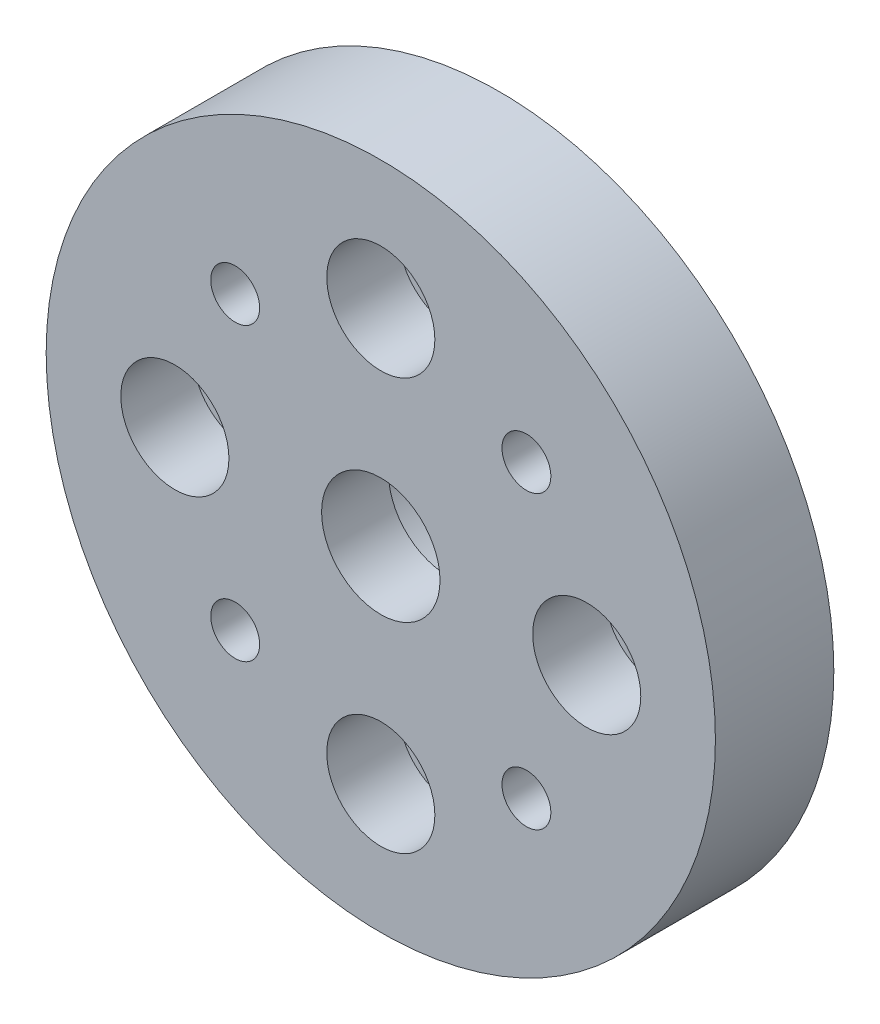
from build123d import *

# Parameters (mm, degrees)
SKETCH_1_R          = 13
SKETCH_1_R_2        = 2.3
SKETCH_1_R_3        = 1.1
SKETCH_1_R_4        = 0.95
EXTRUDE_1_DEPTH     = 4.6
SKETCH_2_R          = 2.1
CUT_EXTRUDE_1_DEPTH = 2.8
SKETCH_9_R          = 4.2
CUT_EXTRUDE_5_DEPTH = 2


with BuildPart() as part:
    # 스케치1 → 보스-돌출1 (new body)
    with BuildSketch(Plane.XY):
        Circle(SKETCH_1_R)
        Circle(SKETCH_1_R_2, mode=Mode.SUBTRACT)
        with Locations((0, 8)):
            Circle(SKETCH_1_R_3, mode=Mode.SUBTRACT)
        with Locations((8, 0)):
            Circle(SKETCH_1_R_3, mode=Mode.SUBTRACT)
        with Locations((0, -8)):
            Circle(SKETCH_1_R_3, mode=Mode.SUBTRACT)
        with Locations((-8, 0)):
            Circle(SKETCH_1_R_3, mode=Mode.SUBTRACT)
        with Locations((5.656854249, 5.656854249)):
            Circle(SKETCH_1_R_4, mode=Mode.SUBTRACT)
        with Locations((5.656854249, -5.656854249)):
            Circle(SKETCH_1_R_4, mode=Mode.SUBTRACT)
        with Locations((-5.656854249, -5.656854249)):
            Circle(SKETCH_1_R_4, mode=Mode.SUBTRACT)
        with Locations((-5.656854249, 5.656854249)):
            Circle(SKETCH_1_R_4, mode=Mode.SUBTRACT)
    extrude(amount=EXTRUDE_1_DEPTH)

    # 스케치2 → 컷-돌출1 (cut)
    with BuildSketch(Plane.XY.offset(4.6)):
        with Locations((0, 8)):
            Circle(SKETCH_2_R)
        with Locations((8, 0)):
            Circle(SKETCH_2_R)
        with Locations((0, -8)):
            Circle(SKETCH_2_R)
        with Locations((-8, 0)):
            Circle(SKETCH_2_R)
    extrude(amount=-CUT_EXTRUDE_1_DEPTH, mode=Mode.SUBTRACT)

    # 스케치9 → 컷-돌출5 (cut)
    with BuildSketch(Plane(origin=(0, 0, 0), x_dir=(-1, 0, 0), z_dir=(0, 0, -1))):
        Circle(SKETCH_9_R)
    extrude(amount=-CUT_EXTRUDE_5_DEPTH, mode=Mode.SUBTRACT)


solid = part.part
